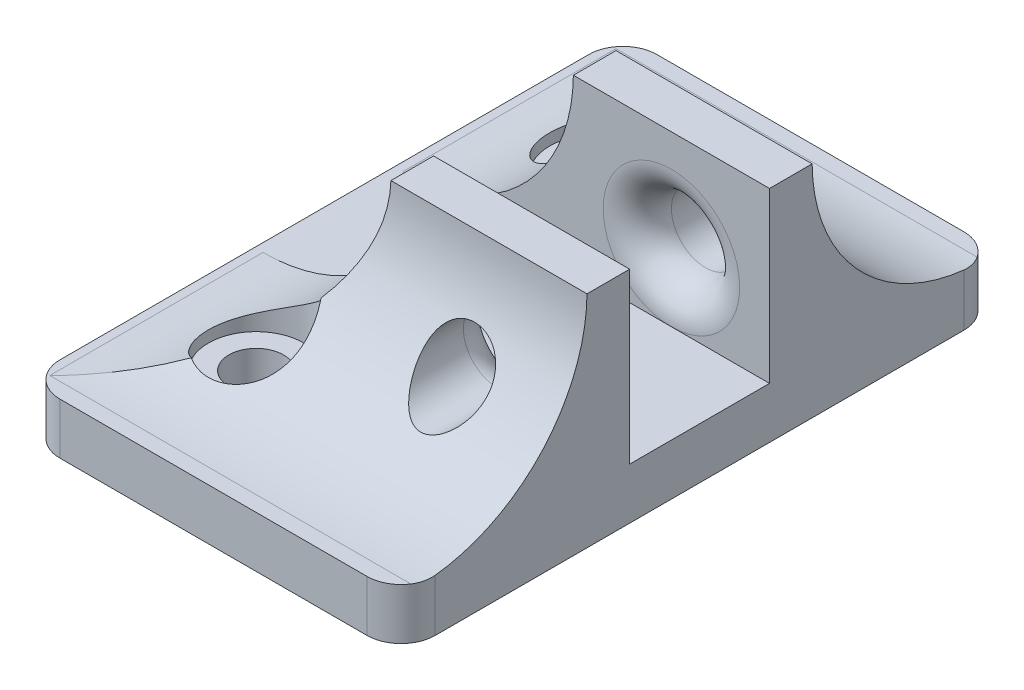
from build123d import *

# Parameters (mm, degrees)
CROQUIS1_W              = 22
CROQUIS1_H              = 35
CROQUIS1_R              = 1.6
SALIENTE_EXTRUIR1_DEPTH = 3
CROQUIS2_W              = 11.5
CROQUIS2_H              = 2.5
SALIENTE_EXTRUIR2_DEPTH = 9.9
CROQUIS4_R              = 2
CORTAR_EXTRUIR1_DEPTH   = 2.5
CORTAR_EXTRUIR2_START   = -2.5
CROQUIS5_R              = 2
CORTAR_EXTRUIR2_DEPTH   = 2.5
CROQUIS6_R              = 2.8
CORTAR_EXTRUIR3_DEPTH   = 0.3
REDONDEO1_R             = 2
REDONDEO2_R             = 10
REDONDEO4_R             = 2


# Some blends are built 0.0001 mm under size
with BuildPart() as part:
    # Croquis1 → Saliente-Extruir1 (new body)
    with BuildSketch(Plane(origin=(0, 0, 0), x_dir=(1, 0, 0), z_dir=(0, 1, 0))):
        with Locations((11, 17.5)):
            Rectangle(CROQUIS1_W, CROQUIS1_H)
        with Locations(Location((6, 27.5, 0), (0, 0, 270))):
            Circle(CROQUIS1_R, mode=Mode.SUBTRACT)
        with Locations(Location((6, 7.5, 0), (0, 0, 270))):
            Circle(CROQUIS1_R, mode=Mode.SUBTRACT)
    extrude(amount=SALIENTE_EXTRUIR1_DEPTH)

    # Croquis2 → Saliente-Extruir2 (add)
    with BuildSketch(Plane(origin=(0, 3, 0), x_dir=(1, 0, 0), z_dir=(0, 1, 0))):
        with Locations((16.25, 22.85)):
            Rectangle(CROQUIS2_W, CROQUIS2_H)
        with Locations((16.25, 12.15)):
            Rectangle(CROQUIS2_W, CROQUIS2_H)
    extrude(amount=SALIENTE_EXTRUIR2_DEPTH)

    # Croquis4 → Cortar-Extruir1 (cut)
    with BuildSketch(Plane.XY.offset(-21.6)):
        with Locations((16.25, 7)):
            Circle(CROQUIS4_R)
    extrude(amount=-CORTAR_EXTRUIR1_DEPTH, mode=Mode.SUBTRACT)

    # Croquis5 → Cortar-Extruir2 (cut)
    with BuildSketch(Plane(origin=(0, 0, -13.4), x_dir=(-1, 0, 0), z_dir=(0, 0, -1)).offset(CORTAR_EXTRUIR2_START)):
        with Locations(Location((-16.25, 7, 0), (0, 0, 180))):
            Circle(CROQUIS5_R)
    extrude(amount=CORTAR_EXTRUIR2_DEPTH, mode=Mode.SUBTRACT)

    # Croquis6 → Cortar-Extruir3 (cut)
    with BuildSketch(Plane(origin=(0, 3, 0), x_dir=(1, 0, 0), z_dir=(0, 1, 0))):
        with Locations(Location((6, 7.5, 0), (0, 0, 270))):
            Circle(CROQUIS6_R)
        with Locations(Location((6, 27.5, 0), (0, 0, 270))):
            Circle(CROQUIS6_R)
    extrude(amount=-CORTAR_EXTRUIR3_DEPTH, mode=Mode.SUBTRACT)

    # Redondeo1
    redondeo1_edges = [part.edges().sort_by_distance(p)[0] for p in [
        (14.25, 7, -21.6),
        (14.25, 7, -13.4),
    ]]
    fillet(redondeo1_edges, radius=REDONDEO1_R - 0.0001)  # a hair under: the kernel refuses the full size

    # Redondeo2
    # the kernel refuses this fillet: 10 mm, written as the material it adds along each edge
    with BuildSketch(Plane(origin=(22, 3, -24.1), x_dir=(0, 0, -1), z_dir=(-1, 0, 0))) as redondeo2_piece_1_section:
        with BuildLine():
            CenterArc((REDONDEO2_R, -REDONDEO2_R), REDONDEO2_R, 90, 90)
            Line((0, -REDONDEO2_R), (0, 0))
            Line((0, 0), (REDONDEO2_R, 0))
        make_face()
    redondeo2_piece_1 = extrude(amount=11.5, mode=Mode.PRIVATE)
    redondeo2_piece_1 = split(redondeo2_piece_1, bisect_by=Plane(origin=(12.416666667, 12.9, -31.511409781), z_dir=(0, -1, 0)), keep=Keep.TOP, mode=Mode.PRIVATE)
    redondeo2_piece_1 = redondeo2_piece_1 - Plane(origin=(16.25, 7, -31.511409781), x_dir=(1, 0, 0), z_dir=(0, 0, 1)) * Cylinder(2, 63, mode=Mode.PRIVATE)
    add(redondeo2_piece_1)
    with BuildSketch(Plane(origin=(10.5, 3, -24.1), x_dir=(-1, 0, 0), z_dir=(0, 0, 1))) as redondeo2_piece_2_section:
        with BuildLine():
            CenterArc((REDONDEO2_R, -REDONDEO2_R), REDONDEO2_R, 90, 90)
            Line((0, -REDONDEO2_R), (0, 0))
            Line((0, 0), (REDONDEO2_R, 0))
        make_face()
    redondeo2_piece_2 = extrude(amount=2.5, mode=Mode.PRIVATE)
    redondeo2_piece_2 = split(redondeo2_piece_2, bisect_by=Plane(origin=(8.234191854, 12.9, -22.85), z_dir=(0, -1, 0)), keep=Keep.TOP, mode=Mode.PRIVATE)
    add(redondeo2_piece_2)
    with BuildSketch(Plane(origin=(10.5, 3, -24.1), x_dir=(-1, 0, 0), z_dir=(0, 0, 1))) as redondeo2_piece_3_section:
        with BuildLine():
            CenterArc((REDONDEO2_R, -REDONDEO2_R), REDONDEO2_R, 90, 90)
            Line((0, -REDONDEO2_R), (0, 0))
            Line((0, 0), (REDONDEO2_R, 0))
        make_face()
    redondeo2_piece_3 = extrude(amount=27.5, mode=Mode.PRIVATE)
    redondeo2_piece_3 = split(redondeo2_piece_3, bisect_by=Plane(origin=(8.234191854, 5.257913166, -13.4), z_dir=(0, 0, 1)), keep=Keep.TOP, mode=Mode.PRIVATE)
    redondeo2_piece_3 = split(redondeo2_piece_3, bisect_by=Plane(origin=(8.234191854, 12.9, -12.15), z_dir=(0, -1, 0)), keep=Keep.TOP, mode=Mode.PRIVATE)
    redondeo2_piece_3 = split(redondeo2_piece_3, bisect_by=Plane(origin=(8.234191854, 5.257913166, -10.9), z_dir=(0, 0, -1)), keep=Keep.TOP, mode=Mode.PRIVATE)
    add(redondeo2_piece_3)
    with BuildSketch(Plane(origin=(10.5, 3, -38.4), x_dir=(-1, 0, 0), z_dir=(0, 0, 1))) as redondeo2_piece_4_section:
        with BuildLine():
            CenterArc((REDONDEO2_R, -REDONDEO2_R), REDONDEO2_R, 90, 90)
            Line((0, -REDONDEO2_R), (0, 0))
            Line((0, 0), (REDONDEO2_R, 0))
        make_face()
    redondeo2_piece_4 = extrude(amount=27.5, mode=Mode.PRIVATE)
    redondeo2_piece_4 = split(redondeo2_piece_4, bisect_by=Plane(origin=(8.234191854, 12.9, -22.85), z_dir=(0, -1, 0)), keep=Keep.TOP, mode=Mode.PRIVATE)
    redondeo2_piece_4 = split(redondeo2_piece_4, bisect_by=Plane(origin=(8.234191854, 5.257913166, -21.6), z_dir=(0, 0, -1)), keep=Keep.TOP, mode=Mode.PRIVATE)
    redondeo2_piece_4 = split(redondeo2_piece_4, bisect_by=Plane(origin=(8.234191854, 5.257913166, -24.1), z_dir=(0, 0, 1)), keep=Keep.TOP, mode=Mode.PRIVATE)
    add(redondeo2_piece_4)
    with BuildSketch(Plane(origin=(10.5, 3, -13.4), x_dir=(-1, 0, 0), z_dir=(0, 0, 1))) as redondeo2_piece_5_section:
        with BuildLine():
            CenterArc((REDONDEO2_R, -REDONDEO2_R), REDONDEO2_R, 90, 90)
            Line((0, -REDONDEO2_R), (0, 0))
            Line((0, 0), (REDONDEO2_R, 0))
        make_face()
    redondeo2_piece_5 = extrude(amount=2.5, mode=Mode.PRIVATE)
    redondeo2_piece_5 = split(redondeo2_piece_5, bisect_by=Plane(origin=(8.234191854, 12.9, -12.15), z_dir=(0, -1, 0)), keep=Keep.TOP, mode=Mode.PRIVATE)
    add(redondeo2_piece_5)
    with BuildSketch(Plane(origin=(10.5, 3, -10.9), x_dir=(0, 0, 1), z_dir=(1, 0, 0))) as redondeo2_piece_6_section:
        with BuildLine():
            CenterArc((REDONDEO2_R, -REDONDEO2_R), REDONDEO2_R, 90, 90)
            Line((0, -REDONDEO2_R), (0, 0))
            Line((0, 0), (REDONDEO2_R, 0))
        make_face()
    redondeo2_piece_6 = extrude(amount=11.5, mode=Mode.PRIVATE)
    redondeo2_piece_6 = split(redondeo2_piece_6, bisect_by=Plane(origin=(20.083333333, 12.9, -3.488590219), z_dir=(0, -1, 0)), keep=Keep.TOP, mode=Mode.PRIVATE)
    redondeo2_piece_6 = redondeo2_piece_6 - Plane(origin=(16.25, 7, -3.488590219), x_dir=(1, 0, 0), z_dir=(0, 0, 1)) * Cylinder(2, 63, mode=Mode.PRIVATE)
    add(redondeo2_piece_6)
    with BuildSketch(Plane(origin=(22, 3, -24.1), x_dir=(0, 0, -1), z_dir=(-1, 0, 0))) as redondeo2_piece_7a_section:
        with BuildLine():
            CenterArc((REDONDEO2_R, -REDONDEO2_R), REDONDEO2_R, 90, 90)
            Line((0, -REDONDEO2_R), (0, 0))
            Line((0, 0), (REDONDEO2_R, 0))
        make_face()
    redondeo2_piece_7a = extrude(amount=36.5, mode=Mode.PRIVATE)
    redondeo2_piece_7a = split(redondeo2_piece_7a, bisect_by=Plane(origin=(0, 3.280401031, -31.512996252), z_dir=(1, 0, 0)), keep=Keep.TOP, mode=Mode.PRIVATE)
    redondeo2_piece_7a = redondeo2_piece_7a - Plane(origin=(6, 3.280401031, -27.5), x_dir=(0, 0, 1), z_dir=(0, 1, 0)) * Cylinder(2.8, 113, mode=Mode.PRIVATE)
    redondeo2_piece_7a = split(redondeo2_piece_7a, bisect_by=Plane(origin=(1.75, 12.9, -31.512996252), z_dir=(0, -1, 0)), keep=Keep.TOP, mode=Mode.PRIVATE)
    redondeo2_piece_7a = split(redondeo2_piece_7a, bisect_by=Plane(origin=(10.5, 3.280401031, -31.512996252), z_dir=(-1, 0, 0)), keep=Keep.TOP, mode=Mode.PRIVATE)
    with BuildSketch(Plane(origin=(10.5, 3, -49.1), x_dir=(-1, 0, 0), z_dir=(0, 0, 1))) as redondeo2_piece_7b_section:
        with BuildLine():
            CenterArc((REDONDEO2_R, -REDONDEO2_R), REDONDEO2_R, 90, 90)
            Line((0, -REDONDEO2_R), (0, 0))
            Line((0, 0), (REDONDEO2_R, 0))
        make_face()
    redondeo2_piece_7b = extrude(amount=27.5, mode=Mode.PRIVATE)
    redondeo2_piece_7b = split(redondeo2_piece_7b, bisect_by=Plane(origin=(8.577465214, 5.522304582, -35), z_dir=(0, 0, 1)), keep=Keep.TOP, mode=Mode.PRIVATE)
    redondeo2_piece_7b = redondeo2_piece_7b - Plane(origin=(6, 5.522304582, -27.5), x_dir=(0, 0, 1), z_dir=(0, 1, 0)) * Cylinder(2.8, 95, mode=Mode.PRIVATE)
    redondeo2_piece_7b = split(redondeo2_piece_7b, bisect_by=Plane(origin=(8.577465214, 12.9, -29.998804987), z_dir=(0, -1, 0)), keep=Keep.TOP, mode=Mode.PRIVATE)
    redondeo2_piece_7b = split(redondeo2_piece_7b, bisect_by=Plane(origin=(8.577465214, 5.522304582, -24.1), z_dir=(0, 0, -1)), keep=Keep.TOP, mode=Mode.PRIVATE)
    redondeo2_piece_7 = redondeo2_piece_7a & redondeo2_piece_7b
    add(redondeo2_piece_7)
    with BuildSketch(Plane(origin=(-14.5, 3, -10.9), x_dir=(0, 0, 1), z_dir=(1, 0, 0))) as redondeo2_piece_8a_section:
        with BuildLine():
            CenterArc((REDONDEO2_R, -REDONDEO2_R), REDONDEO2_R, 90, 90)
            Line((0, -REDONDEO2_R), (0, 0))
            Line((0, 0), (REDONDEO2_R, 0))
        make_face()
    redondeo2_piece_8a = extrude(amount=36.5, mode=Mode.PRIVATE)
    redondeo2_piece_8a = split(redondeo2_piece_8a, bisect_by=Plane(origin=(0, 3.280397801, -3.487004608), z_dir=(1, 0, 0)), keep=Keep.TOP, mode=Mode.PRIVATE)
    redondeo2_piece_8a = redondeo2_piece_8a - Plane(origin=(6, 3.280397801, -7.5), x_dir=(0, 0, 1), z_dir=(0, 1, 0)) * Cylinder(2.8, 113, mode=Mode.PRIVATE)
    redondeo2_piece_8a = split(redondeo2_piece_8a, bisect_by=Plane(origin=(8.75, 12.9, -3.487004608), z_dir=(0, -1, 0)), keep=Keep.TOP, mode=Mode.PRIVATE)
    redondeo2_piece_8a = split(redondeo2_piece_8a, bisect_by=Plane(origin=(10.5, 3.280397801, -3.487004608), z_dir=(-1, 0, 0)), keep=Keep.TOP, mode=Mode.PRIVATE)
    with BuildSketch(Plane(origin=(10.5, 3, -13.4), x_dir=(-1, 0, 0), z_dir=(0, 0, 1))) as redondeo2_piece_8b_section:
        with BuildLine():
            CenterArc((REDONDEO2_R, -REDONDEO2_R), REDONDEO2_R, 90, 90)
            Line((0, -REDONDEO2_R), (0, 0))
            Line((0, 0), (REDONDEO2_R, 0))
        make_face()
    redondeo2_piece_8b = extrude(amount=27.5, mode=Mode.PRIVATE)
    redondeo2_piece_8b = split(redondeo2_piece_8b, bisect_by=Plane(origin=(8.577464667, 5.522304516, 0), z_dir=(0, 0, -1)), keep=Keep.TOP, mode=Mode.PRIVATE)
    redondeo2_piece_8b = redondeo2_piece_8b - Plane(origin=(6, 5.522304516, -7.5), x_dir=(0, 0, 1), z_dir=(0, 1, 0)) * Cylinder(2.8, 95, mode=Mode.PRIVATE)
    redondeo2_piece_8b = split(redondeo2_piece_8b, bisect_by=Plane(origin=(8.577464667, 12.9, -5.00119928), z_dir=(0, -1, 0)), keep=Keep.TOP, mode=Mode.PRIVATE)
    redondeo2_piece_8b = split(redondeo2_piece_8b, bisect_by=Plane(origin=(8.577464667, 5.522304516, -10.9), z_dir=(0, 0, 1)), keep=Keep.TOP, mode=Mode.PRIVATE)
    redondeo2_piece_8 = redondeo2_piece_8a & redondeo2_piece_8b
    add(redondeo2_piece_8)

    # Redondeo4
    redondeo4_edges = [part.edges().sort_by_distance(p)[0] for p in [
        (0, 1.5, -35),
        (0, 1.5, 0),
        (22, 1.5, 0),
        (22, 1.5, -35),
    ]]
    fillet(redondeo4_edges, radius=REDONDEO4_R)


solid = part.part
